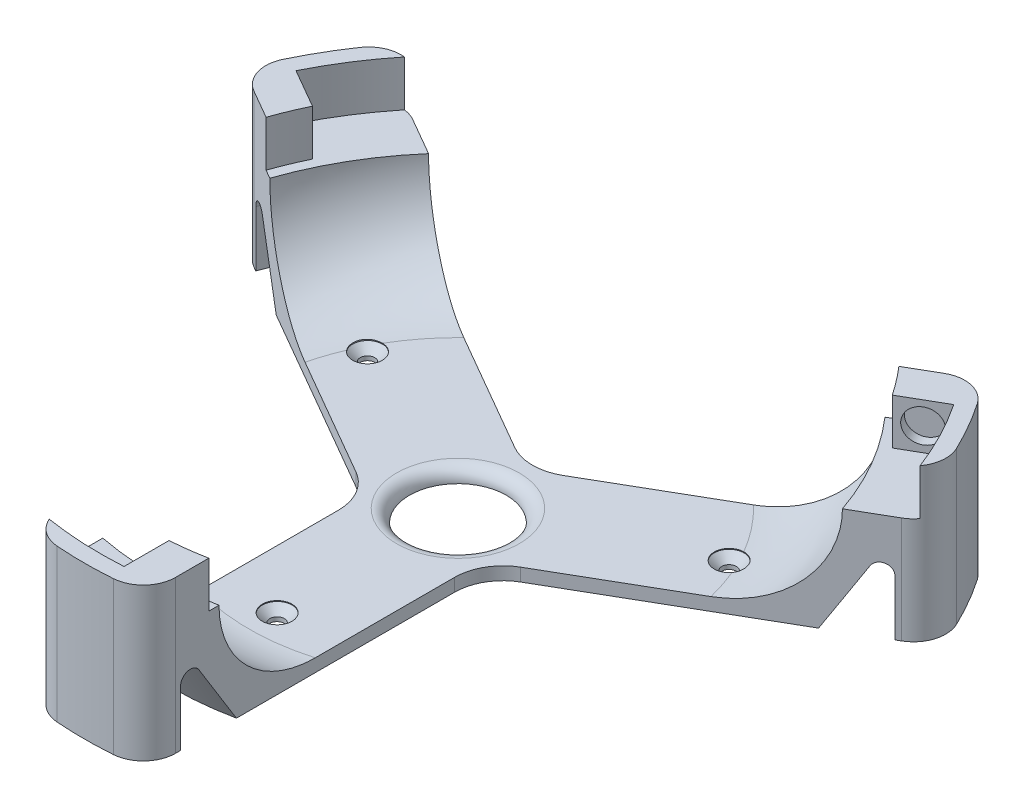
from build123d import *

# Parameters (mm, degrees)
SKETCH2_R                                      = 115.75
SKETCH2_R_2                                    = 93.75
BOSS_EXTRUDE1_DEPTH                            = 29
BOSS_EXTRUDE2_START                            = 4
SKETCH5_R                                      = 115.75
BOSS_EXTRUDE2_DEPTH                            = 4
CUT_EXTRUDE1_DEPTH                             = 167.98839782
CUT_EXTRUDE2_DEPTH                             = 20
CUT_EXTRUDE2_DEPTH_BACK                        = 0.25
SKETCH9_R                                      = 4.6
SKETCH15_R                                     = 15
CUT_EXTRUDE5_DEPTH                             = 12
FILLET1_R                                      = 15
FILLET2_R                                      = 10
FILLET4_R                                      = 4
CSK_FOR_M4_FLAT_HEAD_MACHINE_SCREW3_AT_2_COUNT = 2
CSK_FOR_M4_FLAT_HEAD_MACHINE_SCREW3_AT_2_PITCH = 100.955435713
CSK_FOR_M4_FLAT_HEAD_MACHINE_SCREW3_AT_3_COUNT = 2
CSK_FOR_M4_FLAT_HEAD_MACHINE_SCREW3_AT_3_PITCH = 100.955435713
BOSS_EXTRUDE4_DEPTH                            = 14.2
SKETCH20_R                                     = 5.1
CUT_EXTRUDE9_DEPTH                             = 3.1
CIRPATTERN1_COUNT                              = 3
FILLET5_R                                      = 3


with BuildPart() as part:
    # Sketch2 → Boss-Extrude1 (new body)
    with BuildSketch(Plane(origin=(0, 0, 0), x_dir=(1, 0, 0), z_dir=(0, 1, 0))):
        with Locations(Location((0, 0, 0), (0, 0, 90))):
            Circle(SKETCH2_R)
        with Locations(Location((0, 0, 0), (0, 0, 90))):
            Circle(SKETCH2_R_2, mode=Mode.SUBTRACT)
    extrude(amount=BOSS_EXTRUDE1_DEPTH)

    # Sketch4 → Revolve5 (revolve)
    with BuildSketch(Plane.XY):
        with BuildLine():
            Line((93.75, 29), (93.75, 0))
            Line((93.75, 0), (64.75, 0))
            add(Edge.make_bspline(
                [(64.75, 0), (93.75, 0), (93.75, 29)],
                knots=[0, 0, 0, 1.570796327, 1.570796327, 1.570796327], degree=2, weights=[1, 0.707106781, 1]))
        make_face()
    revolve(axis=Axis((0, 29, 0), (0, -1, 0)))

    # Sketch5 → Boss-Extrude2 (add)
    with BuildSketch(Plane.XZ.offset(BOSS_EXTRUDE2_START)):
        with Locations(Location((0, 0, 0), (0, 0, 270))):
            Circle(SKETCH5_R)
    extrude(amount=-BOSS_EXTRUDE2_DEPTH)

    # Sketch6 → Cut-Extrude1 (cut, through all)
    with BuildSketch(Plane.XZ.offset(4)):
        with BuildLine():
            Line((18, 10.392304845), (18, 58.283788484))
            Line((18, 58.283788484), (18, 148.916083752))
            ThreePointArc((18, 148.916083752), (129.903810568, 75), (137.965111561, -58.869584608))
            Line((137.965111561, -58.869584608), (59.475241456, -13.553436974))
            Line((59.475241456, -13.553436974), (18, 10.392304845))
        make_face()
        with BuildLine():
            Line((-18, 10.392304845), (-18, 58.283788484))
            Line((-18, 58.283788484), (-18, 148.916083752))
            ThreePointArc((-18, 148.916083752), (-129.903810568, 75), (-137.965111561, -58.869584608))
            Line((-137.965111561, -58.869584608), (-59.475241456, -13.553436974))
            Line((-59.475241456, -13.553436974), (-18, 10.392304845))
        make_face()
        with BuildLine():
            Line((0, -20.784609691), (41.475241456, -44.73035151))
            Line((41.475241456, -44.73035151), (119.965111561, -90.046499144))
            ThreePointArc((119.965111561, -90.046499144), (0, -150), (-119.965111561, -90.046499144))
            Line((-119.965111561, -90.046499144), (-41.475241456, -44.73035151))
            Line((-41.475241456, -44.73035151), (0, -20.784609691))
        make_face()
    extrude(amount=-CUT_EXTRUDE1_DEPTH, mode=Mode.SUBTRACT)

    # Sketch9 → Cut-Extrude2 (cut, two sides: drawn at the far end of the back side and taken through both)
    with BuildSketch(Plane(origin=(0, 0, 0), x_dir=(1, 0, 0), z_dir=(0, 1, 0)).offset(-CUT_EXTRUDE2_DEPTH_BACK)):
        with Locations(Location((0, -56, 0), (0, 0, 270))):
            Circle(SKETCH9_R)
        with Locations(Location((-56, 28, 0), (0, 0, 270))):
            Circle(SKETCH9_R)
        with Locations(Location((56, 28, 0), (0, 0, 270))):
            Circle(SKETCH9_R)
    extrude(amount=CUT_EXTRUDE2_DEPTH + CUT_EXTRUDE2_DEPTH_BACK, mode=Mode.SUBTRACT)

    # Sketch15 → Cut-Extrude5 (cut)
    with BuildSketch(Plane(origin=(0, 0, 0), x_dir=(1, 0, 0), z_dir=(0, 1, 0))):
        with Locations(Location((0, 0, 0), (0, 0, 270))):
            Circle(SKETCH15_R)
    extrude(amount=-CUT_EXTRUDE5_DEPTH, mode=Mode.SUBTRACT)

    # Fillet1
    fillet1_edges = [part.edges().sort_by_distance(p)[0] for p in [
        (-18, -2, 10.392304845),
        (18, -2, 10.392304845),
        (0, -2, -20.784609691),
    ]]
    fillet(fillet1_edges, radius=FILLET1_R)

    # Fillet2
    fillet2_edges = [part.edges().sort_by_distance(p)[0] for p in [
        (-18, 12.5, 114.341866786),
        (-108.022961352, 12.5, -41.582476125),
        (108.022961352, 12.5, -41.582476125),
        (18, 12.5, 114.341866786),
        (-90.022961352, 12.5, -72.759390661),
        (90.022961352, 12.5, -72.759390661),
    ]]
    fillet(fillet2_edges, radius=FILLET2_R)

    # Fillet4
    fillet4_edges = [part.edges().sort_by_distance(p)[0] for p in [
        (0, 0, -15),
    ]]
    fillet(fillet4_edges, radius=FILLET4_R - 0.0001)  # a hair under: the kernel refuses the full size

    # Sketch14 → CSK for M4 Flat Head Machine Screw3 (revolve, cut)
    with BuildSketch(Plane(origin=(0, -0.25, 56), x_dir=(0, 0, 1), z_dir=(1, 0, 0))):
        Polygon((0, 0), (0, 3.75), (2.25, 3.75), (2.25, 2.45), (4.7, 0), align=None)
    csk_for_m4_flat_head_machine_screw3 = revolve(axis=Axis((0, 6.1, 56), (0, -1, 0)), mode=Mode.SUBTRACT)

    # CSK for M4 Flat Head Machine Screw3 at 2: CSK for M4 Flat Head Machine Screw3 ×2
    with Locations(*[Vector(-0.5547001962252337, 0, -0.8320502943378407) * (i * CSK_FOR_M4_FLAT_HEAD_MACHINE_SCREW3_AT_2_PITCH) for i in range(1, CSK_FOR_M4_FLAT_HEAD_MACHINE_SCREW3_AT_2_COUNT)]):
        add(csk_for_m4_flat_head_machine_screw3, mode=Mode.SUBTRACT)

    # CSK for M4 Flat Head Machine Screw3 at 3: CSK for M4 Flat Head Machine Screw3 ×2
    with Locations(*[Vector(0.554700196225225, 0, -0.8320502943378464) * (i * CSK_FOR_M4_FLAT_HEAD_MACHINE_SCREW3_AT_3_PITCH) for i in range(1, CSK_FOR_M4_FLAT_HEAD_MACHINE_SCREW3_AT_3_COUNT)]):
        add(csk_for_m4_flat_head_machine_screw3, mode=Mode.SUBTRACT)

    # Sketch16 → Boss-Extrude4 (add)
    with BuildSketch(Plane(origin=(0, 29, 0), x_dir=(1, 0, 0), z_dir=(0, 1, 0))):
        with BuildLine():
            Line((-91.413238469, 31.992848147), (-100.319750739, 37.135025403))
            ThreePointArc((-100.319750739, 37.135025403), (-101.968262234, 38.32552075), (-103.341866466, 39.824880857))
            ThreePointArc((-103.341866466, 39.824880857), (-105.273739789, 44.837103058), (-104.333438752, 50.12580232))
            ThreePointArc((-104.333438752, 50.12580232), (-100.242440488, 57.875), (-95.57693757, 65.292507264))
            ThreePointArc((-95.57693757, 65.292507264), (-91.466940175, 68.75118148), (-86.160291758, 69.584241206))
            ThreePointArc((-86.160291758, 69.584241206), (-93.275994885, 59.708887766), (-99.265016455, 49.112310149))
            Line((-99.265016455, 49.112310149), (-87.198875515, 42.145920429))
            ThreePointArc((-87.198875515, 42.145920429), (-89.450226577, 37.129226565), (-91.413238469, 31.992848147))
        make_face()
    boss_extrude4 = extrude(amount=BOSS_EXTRUDE4_DEPTH)

    # Sketch20 → Cut-Extrude9 (cut)
    with BuildSketch(Plane(origin=(-3.55, 0, 6.148780367), x_dir=(-0.8660254037844387, 0, -0.49999999999999983), z_dir=(0.49999999999999983, 0, -0.8660254037844387))):
        with Locations((103.589401593, 36.2)):
            Circle(SKETCH20_R)
    cut_extrude9 = extrude(amount=-CUT_EXTRUDE9_DEPTH, mode=Mode.SUBTRACT)

    # CirPattern1: Boss-Extrude4, Cut-Extrude9 ×3 about axis
    cirpattern1_axis = Axis((0, 0, 0), (0, 1, 0))
    add([boss_extrude4.rotate(cirpattern1_axis, i * 360 / CIRPATTERN1_COUNT) for i in range(1, CIRPATTERN1_COUNT)])
    add([cut_extrude9.rotate(cirpattern1_axis, i * 360 / CIRPATTERN1_COUNT) for i in range(1, CIRPATTERN1_COUNT)], mode=Mode.SUBTRACT)

    # Sketch22 → Cut-Revolve1 (revolve, cut)
    with BuildSketch(Plane(origin=(0, 0, 0), x_dir=(-0.866025403784433, 0, -0.5000000000000099), z_dir=(0.5000000000000098, 0, -0.8660254037844329)), mode=Mode.PRIVATE) as cut_revolve1_sk:
        Polygon((105.446965343, -4), (105.446965343, 24), (88.446965343, -4), align=None)
    revolve(cut_revolve1_sk.sketch.rotate(Axis((0, 29, 0), (0, -1, 0)), 60), axis=Axis((0, 29, 0), (0, -1, 0)), mode=Mode.SUBTRACT)

    # Fillet5
    fillet5_edges = [part.edges().sort_by_distance(p)[0] for p in [
        (91.319750739, 24, -52.723482671),
        (0, 24, 105.446965343),
        (-91.319750739, 24, -52.723482671),
    ]]
    fillet(fillet5_edges, radius=FILLET5_R)


solid = part.part
